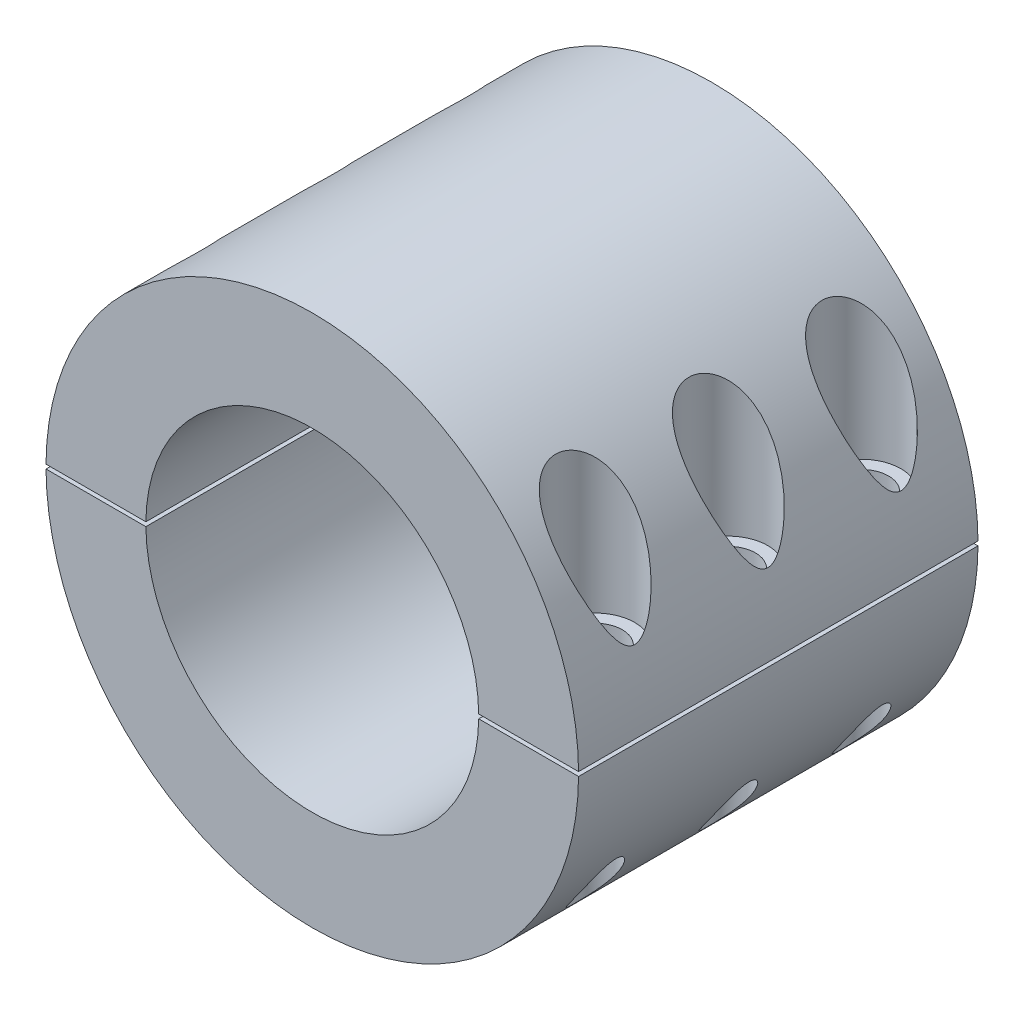
from build123d import *

# Parameters (mm, degrees)
SKETCH1_R                       = 50.8
SKETCH1_R_2                     = 31.75
BOSS_EXTRUDE1_DEPTH             = 76.2
CUT_EXTRUDE1_DEPTH              = 105.726882891
CUT_EXTRUDE1_DEPTH_BACK         = 105.726882891
SKETCH2_W                       = 127
SKETCH2_H                       = 0.8001
CUT_EXTRUDE2_DEPTH              = 125.147945452
CUT_EXTRUDE2_DEPTH_BACK         = 22.86
SKETCH3_R                       = 7.540625
SKETCH4_R                       = 5.1562
CUT_EXTRUDE3_DEPTH              = 9.75995
F_3_8_16_START                  = -34.480192747
F_3_8_16_TAPPED_HOLE1_OUTLINE_R = 3.96875
F_3_8_16_TAPPED_HOLE1_DEPTH     = 34.080142747


with BuildPart() as part:
    # Sketch1 → Boss-Extrude1 (new body)
    with BuildSketch(Plane.XY):
        with Locations(Location((0, 0, 0), (0, 0, 180))):
            Circle(SKETCH1_R)
        with Locations(Location((0, 0, 0), (0, 0, 180))):
            Circle(SKETCH1_R_2, mode=Mode.SUBTRACT)
    extrude(amount=BOSS_EXTRUDE1_DEPTH)

    # Sketch2 → Cut-Extrude1 (cut, two sides: drawn at the far end of the back side and taken through both)
    with BuildSketch(Plane.XY.offset(76.2).offset(-CUT_EXTRUDE1_DEPTH_BACK)):
        Rectangle(SKETCH2_W, SKETCH2_H)
    extrude(amount=CUT_EXTRUDE1_DEPTH + CUT_EXTRUDE1_DEPTH_BACK, mode=Mode.SUBTRACT)


with BuildPart() as cut_extrude1_piece_1:
    # of the separate pieces the step leaves, piece 1, a body of its own (cut_extrude1_pieces)
    add(part.part.solids().sort_by_distance((50.798424779, 0.40005, 0))[0])

    # Sketch3 → Cut-Extrude2 (cut, two sides: drawn at the far end of the back side and taken through both)
    with BuildSketch(Plane(origin=(0, 33.02, 0), x_dir=(1, 0, 0), z_dir=(0, 1, 0)).offset(-CUT_EXTRUDE2_DEPTH_BACK)):
        with Locations(Location((-41.275, -12.7, 0), (0, 0, 90))):
            Circle(SKETCH3_R)
        with Locations(Location((-41.275, -38.1, 0), (0, 0, 90))):
            Circle(SKETCH3_R)
        with Locations(Location((-41.275, -63.5, 0), (0, 0, 90))):
            Circle(SKETCH3_R)
        with Locations(Location((41.275, -63.5, 0), (0, 0, 90))):
            Circle(SKETCH3_R)
        with Locations(Location((41.275, -38.1, 0), (0, 0, 90))):
            Circle(SKETCH3_R)
        with Locations(Location((41.275, -12.7, 0), (0, 0, 90))):
            Circle(SKETCH3_R)
    extrude(amount=CUT_EXTRUDE2_DEPTH + CUT_EXTRUDE2_DEPTH_BACK, mode=Mode.SUBTRACT)

    # Sketch4 → Cut-Extrude3 (cut)
    with BuildSketch(Plane(origin=(0, 10.16, 0), x_dir=(1, 0, 0), z_dir=(0, 1, 0))):
        with Locations(Location((-41.275, -12.7, 0), (0, 0, 270))):
            Circle(SKETCH4_R)
        with Locations(Location((-41.275, -38.1, 0), (0, 0, 270))):
            Circle(SKETCH4_R)
        with Locations(Location((-41.275, -63.5, 0), (0, 0, 270))):
            Circle(SKETCH4_R)
        with Locations(Location((41.275, -12.7, 0), (0, 0, 270))):
            Circle(SKETCH4_R)
        with Locations(Location((41.275, -38.1, 0), (0, 0, 270))):
            Circle(SKETCH4_R)
        with Locations(Location((41.275, -63.5, 0), (0, 0, 270))):
            Circle(SKETCH4_R)
    extrude(amount=-CUT_EXTRUDE3_DEPTH, mode=Mode.SUBTRACT)


with BuildPart() as cut_extrude1_piece_2:
    # of the separate pieces the step leaves, piece 2, a body of its own (cut_extrude1_pieces)
    add(part.part.solids().sort_by_distance((-50.798424779, -0.40005, 0))[0])

    # 3/8-16 Tapped Hole1: read off the stored shape, not the designer's step
    # 3/8-16 Tapped Hole1 outline → 3/8-16 Tapped Hole1 (cut)
    with BuildSketch(Plane(origin=(0, 0, 0), x_dir=(1, 0, 0), z_dir=(0, 1, 0)).offset(F_3_8_16_START)):
        with Locations((41.275, -63.5)):
            Circle(F_3_8_16_TAPPED_HOLE1_OUTLINE_R)
        with Locations((41.275, -38.1)):
            Circle(F_3_8_16_TAPPED_HOLE1_OUTLINE_R)
        with Locations((41.275, -12.7)):
            Circle(F_3_8_16_TAPPED_HOLE1_OUTLINE_R)
        with Locations((-41.275, -63.5)):
            Circle(F_3_8_16_TAPPED_HOLE1_OUTLINE_R)
        with Locations((-41.275, -38.1)):
            Circle(F_3_8_16_TAPPED_HOLE1_OUTLINE_R)
        with Locations((-41.275, -12.7)):
            Circle(F_3_8_16_TAPPED_HOLE1_OUTLINE_R)
    extrude(amount=F_3_8_16_TAPPED_HOLE1_DEPTH, mode=Mode.SUBTRACT)


solid = Compound([cut_extrude1_piece_1.part, cut_extrude1_piece_2.part])
